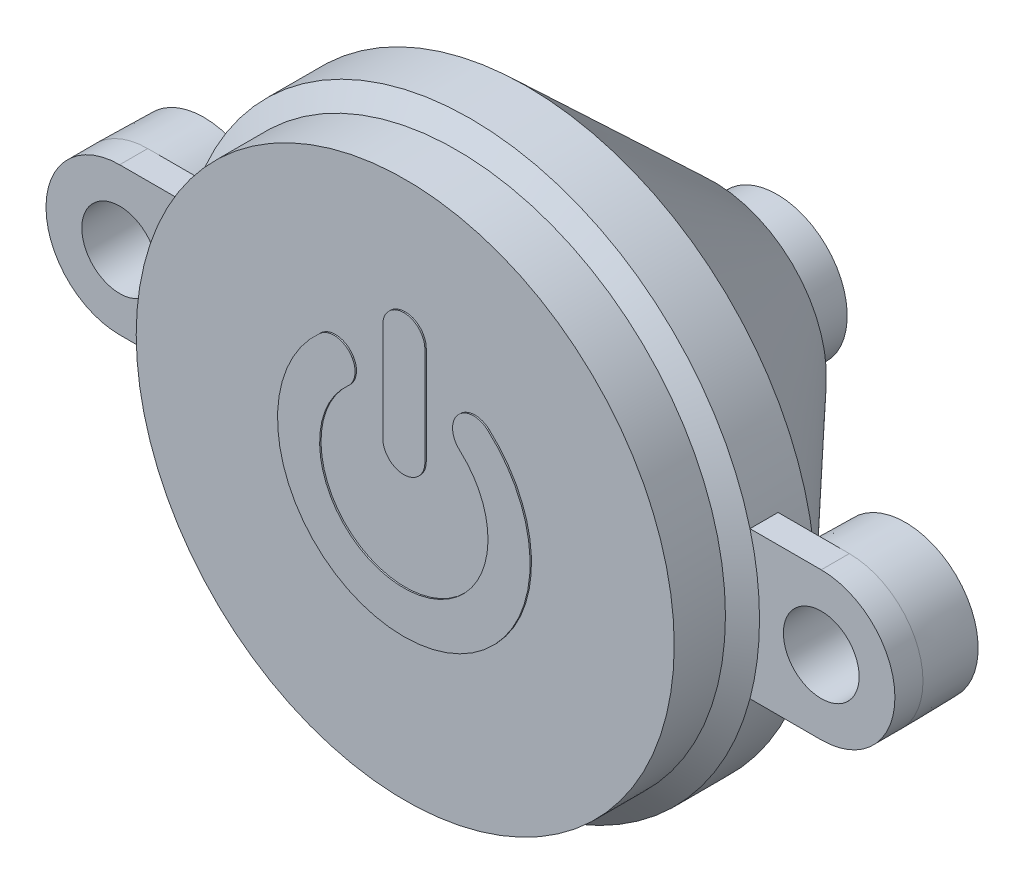
from build123d import *

# Parameters (mm, degrees)
SKETCH_1_R          = 20.6
EXTRUDE_1_DEPTH     = 4
SKETCH_2_R          = 20.6
EXTRUDE_2_DEPTH     = 1
EXTRUDE_2_TAPER     = 55
SKETCH_3_R          = 19.171851993
EXTRUDE_3_DEPTH     = 3.65
SKETCH_4_R          = 20.6
EXTRUDE_4_DEPTH     = 13.35
EXTRUDE_4_TAPER     = 43.3
SKETCH_5_R          = 5
SKETCH_5_R_2        = 3
EXTRUDE_5_DEPTH     = 4.5
EXTRUDE_START       = 2
EXTRUDE_6_DEPTH     = 2
SKETCH_7_R          = 5.25
EXTRUDE_8_DEPTH     = 4
EXTRUDE_8_TAPER     = 1
SKETCH_8_R          = 2.7
CUT_EXTRUDE_1_DEPTH = 4
SKETCH_9_R          = 1.6
CUT_EXTRUDE_2_DEPTH = 4
SKETCH_10_W         = 3
SKETCH_10_H         = 10
EXTRUDE_9_DEPTH     = 0.1
FILLET_1_R          = 1.5


with BuildPart() as part:
    # 草图1 → 凸台-拉伸1 (new body)
    with BuildSketch(Plane.XY):
        Circle(SKETCH_1_R)
    extrude(amount=EXTRUDE_1_DEPTH)

    # 草图2 → 凸台-拉伸2 (add)
    with BuildSketch(Plane.XY.offset(4)):
        Circle(SKETCH_2_R)
    extrude(amount=EXTRUDE_2_DEPTH, taper=EXTRUDE_2_TAPER)

    # 草图3 → 凸台-拉伸3 (add)
    with BuildSketch(Plane.XY.offset(5)):
        Circle(SKETCH_3_R)
    extrude(amount=EXTRUDE_3_DEPTH)

    # 草图4 → 凸台-拉伸4 (add)
    with BuildSketch(Plane(origin=(0, 0, 0), x_dir=(-1, 0, 0), z_dir=(0, 0, -1))):
        Circle(SKETCH_4_R)
    extrude(amount=EXTRUDE_4_DEPTH, taper=EXTRUDE_4_TAPER)

    # 草图5 → 凸台-拉伸5 (add)
    with BuildSketch(Plane(origin=(0, 0, -13.35), x_dir=(-1, 0, 0), z_dir=(0, 0, -1))):
        Circle(SKETCH_5_R)
        Circle(SKETCH_5_R_2, mode=Mode.SUBTRACT)
    extrude(amount=EXTRUDE_5_DEPTH)

    # 草图6 → 凸台-拉伸6 (add)
    with BuildSketch(Plane.XY.offset(EXTRUDE_START)):
        with BuildLine():
            Line((25, 5.25), (19.069776605, 5.25))
            Line((19.069776605, 5.25), (19.069776605, -5.25))
            Line((19.069776605, -5.25), (25, -5.25))
            ThreePointArc((25, -5.25), (30.25, 0), (25, 5.25))
        make_face()
    extrude_6 = extrude(amount=EXTRUDE_6_DEPTH)

    # 草图7 → 凸台-拉伸8 (add)
    with BuildSketch(Plane(origin=(0, 0, 2), x_dir=(-1, 0, 0), z_dir=(0, 0, -1))):
        with Locations((-25, 0)):
            Circle(SKETCH_7_R)
    extrude_8 = extrude(amount=EXTRUDE_8_DEPTH, taper=EXTRUDE_8_TAPER)

    # 草图8 → 切除-拉伸1 (cut)
    with BuildSketch(Plane.XY.offset(4)):
        with Locations((25, 0)):
            Circle(SKETCH_8_R)
    cut_extrude_1 = extrude(amount=-CUT_EXTRUDE_1_DEPTH, mode=Mode.SUBTRACT)

    # 草图9 → 切除-拉伸2 (cut)
    with BuildSketch(Plane.XY):
        with Locations((25, 0)):
            Circle(SKETCH_9_R)
    cut_extrude_2 = extrude(amount=-CUT_EXTRUDE_2_DEPTH, mode=Mode.SUBTRACT)

    # 镜向1: 凸台-拉伸6, 凸台-拉伸8, 切除-拉伸1, 切除-拉伸2 across plane
    add(extrude_6.mirror(Plane(origin=(0, 0, 0), x_dir=(0, 0, 1), z_dir=(1, 0, 0))))
    add(extrude_8.mirror(Plane(origin=(0, 0, 0), x_dir=(0, 0, 1), z_dir=(1, 0, 0))))
    add(cut_extrude_1.mirror(Plane(origin=(0, 0, 0), x_dir=(0, 0, 1), z_dir=(1, 0, 0))), mode=Mode.SUBTRACT)
    add(cut_extrude_2.mirror(Plane(origin=(0, 0, 0), x_dir=(0, 0, 1), z_dir=(1, 0, 0))), mode=Mode.SUBTRACT)

    # 草图10 → 凸台-拉伸9 (add)
    with BuildSketch(Plane.XY.offset(8.65)):
        with BuildLine():
            Line((-3, 5.196152423), (-4.5, 7.794228634))
            ThreePointArc((-4.5, 7.794228634), (0, -9), (4.5, 7.794228634))
            Line((4.5, 7.794228634), (3, 5.196152423))
            ThreePointArc((3, 5.196152423), (0, -6), (-3, 5.196152423))
        make_face()
        with Locations((0, 6)):
            Rectangle(SKETCH_10_W, SKETCH_10_H)
    extrude(amount=EXTRUDE_9_DEPTH)

    # 圆角1
    fillet_1_edges = [part.edges().sort_by_distance(p)[0] for p in [
        (-3, 5.196152423, 8.7),
        (-4.5, 7.794228634, 8.7),
        (1.5, 1, 8.7),
        (-1.5, 1, 8.7),
        (1.5, 11, 8.7),
        (-1.5, 11, 8.7),
        (4.5, 7.794228634, 8.7),
        (3, 5.196152423, 8.7),
    ]]
    fillet(fillet_1_edges, radius=FILLET_1_R - 0.0001)  # a hair under: the kernel refuses the full size


solid = part.part
